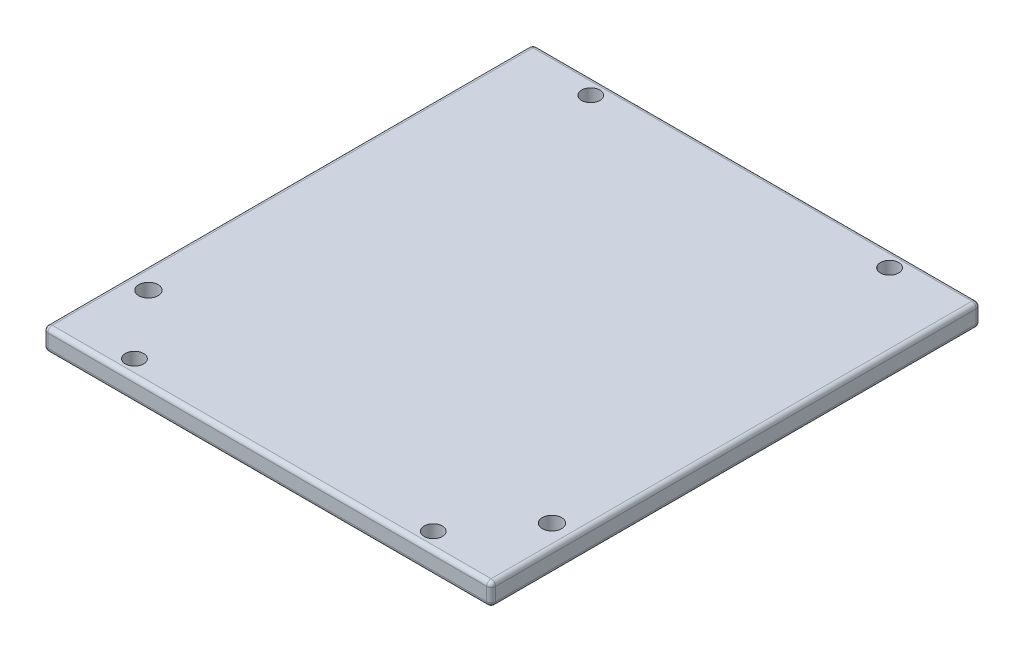
from build123d import *

# Parameters (mm, degrees)
SKETCH1_W                 = 81
SKETCH1_H                 = 88.55
SKETCH1_R                 = 1.75
SKETCH1_R_2               = 1.65
BOSS_EXTRUDE1_DEPTH       = 4
FILLET3_R                 = 0.8
SKETCH2_W                 = 5
SKETCH2_H                 = 20
BOSS_EXTRUDE2_DEPTH       = 8.8
SKETCH5_W                 = 3.2
SKETCH5_H                 = 6.8
CUT_EXTRUDE1_DEPTH        = 94.320362194
FILLET1_SIZE              = 3
FILLET1_SIZE_2            = 5
FILLET2_R                 = 0.5
FILLET1_OF_MIRROR1_SIZE   = 3
FILLET1_OF_MIRROR1_SIZE_2 = 5
FILLET2_OF_MIRROR1_R      = 0.5


with BuildPart() as part:
    # Sketch1 → Boss-Extrude1 (new body)
    with BuildSketch(Plane(origin=(0, 0, 0), x_dir=(1, 0, 0), z_dir=(0, 1, 0))):
        with Locations((40.5, 44.275)):
            Rectangle(SKETCH1_W, SKETCH1_H)
        with Locations(Location((4, 15, 0), (0, 0, 270))):
            Circle(SKETCH1_R, mode=Mode.SUBTRACT)
        with Locations(Location((13.475, 3, 0), (0, 0, 270))):
            Circle(SKETCH1_R_2, mode=Mode.SUBTRACT)
        with Locations(Location((13.475, 85.55, 0), (0, 0, 270))):
            Circle(SKETCH1_R_2, mode=Mode.SUBTRACT)
        with Locations(Location((77, 15, 0), (0, 0, 90))):
            Circle(SKETCH1_R, mode=Mode.SUBTRACT)
        with Locations(Location((67.525, 3, 0), (0, 0, 90))):
            Circle(SKETCH1_R_2, mode=Mode.SUBTRACT)
        with Locations(Location((67.525, 85.55, 0), (0, 0, 90))):
            Circle(SKETCH1_R_2, mode=Mode.SUBTRACT)
    extrude(amount=BOSS_EXTRUDE1_DEPTH)

    # Fillet3
    fillet3_edges = [part.edges().sort_by_distance(p)[0] for p in [
        (81, 4, -44.275),
        (40.5, 4, -88.55),
        (0, 4, -44.275),
        (40.5, 0, -88.55),
        (81, 0, -44.275),
        (40.5, 0, 0),
        (0, 0, -44.275),
        (0, 2, -88.55),
        (81, 2, -88.55),
        (81, 2, 0),
        (0, 2, 0),
        (40.5, 4, 0),
    ]]
    fillet(fillet3_edges, radius=FILLET3_R)

    # Sketch2 → Boss-Extrude2 (add)
    with BuildSketch(Plane.XZ):
        with Locations((13.25, -35.5)):
            Rectangle(SKETCH2_W, SKETCH2_H)
    boss_extrude2 = extrude(amount=BOSS_EXTRUDE2_DEPTH)

    # Sketch5 → Cut-Extrude1 (cut, through all)
    with BuildSketch(Plane(origin=(0, 0, -45.5), x_dir=(-1, 0, 0), z_dir=(0, 0, -1))):
        with Locations((-12.35, -3.4)):
            Rectangle(SKETCH5_W, SKETCH5_H)
    cut_extrude1 = extrude(amount=-CUT_EXTRUDE1_DEPTH, mode=Mode.SUBTRACT)

    # Fillet1
    # an asymmetric fillet: 5, 3 mm, written as the material it adds along each edge
    with BuildSketch(Plane(origin=(15.75, 0, -25.5), x_dir=(1, 0, 0), z_dir=(0, 0, -1))) as fillet1_piece_1:
        with BuildLine():
            Bezier((FILLET1_SIZE, 0), (0, 0), (0, FILLET1_SIZE_2), weights=[1, 0.707106781, 1])
            Line((0, FILLET1_SIZE_2), (0, 0))
            Line((0, 0), (FILLET1_SIZE, 0))
        make_face()
    extrude(amount=20)

    # Fillet2
    fillet2_edges = [part.edges().sort_by_distance(p)[0] for p in [
        (13.25, -8.8, -25.5),
        (13.25, -8.8, -45.5),
        (10.75, -7.8, -25.5),
        (10.75, -7.8, -45.5),
        (10.75, -6.8, -35.5),
        (13.95, -3.4, -45.5),
        (13.95, -3.4, -25.5),
        (10.75, -8.8, -35.5),
        (15.75, -8.8, -35.5),
    ]]
    fillet(fillet2_edges, radius=FILLET2_R)

    # Mirror1: Boss-Extrude2, Cut-Extrude1 across plane
    add(boss_extrude2.mirror(Plane.ZY.offset(-40.5)))
    add(cut_extrude1.mirror(Plane.ZY.offset(-40.5)), mode=Mode.SUBTRACT)

    # Fillet1 of Mirror1
    # an asymmetric fillet: 5, 3 mm, written as the material it adds along each edge
    with BuildSketch(Plane(origin=(65.25, 0, -25.5), x_dir=(-1, 0, 0), z_dir=(0, 0, -1))) as fillet1_of_mirror1_piece_1:
        with BuildLine():
            Bezier((FILLET1_OF_MIRROR1_SIZE, 0), (0, 0), (0, -FILLET1_OF_MIRROR1_SIZE_2), weights=[1, 0.707106781, 1])
            Line((0, -FILLET1_OF_MIRROR1_SIZE_2), (0, 0))
            Line((0, 0), (FILLET1_OF_MIRROR1_SIZE, 0))
        make_face()
    extrude(amount=20)

    # Fillet2 of Mirror1
    fillet2_of_mirror1_edges = [part.edges().sort_by_distance(p)[0] for p in [
        (67.75, -8.8, -25.5),
        (67.75, -8.8, -45.5),
        (70.25, -7.8, -25.5),
        (70.25, -7.8, -45.5),
        (70.25, -6.8, -35.5),
        (67.05, -3.4, -45.5),
        (67.05, -3.4, -25.5),
        (70.25, -8.8, -35.5),
        (65.25, -8.8, -35.5),
    ]]
    fillet(fillet2_of_mirror1_edges, radius=FILLET2_OF_MIRROR1_R)


solid = part.part
